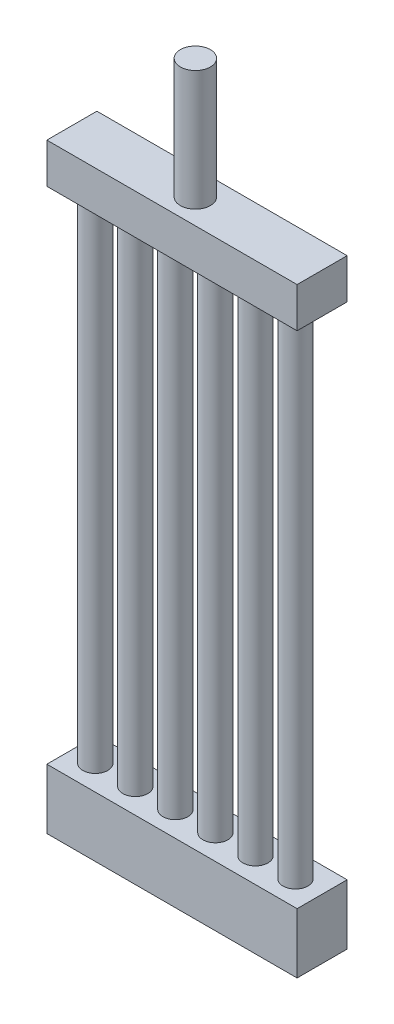
from build123d import *

# Parameters (mm, degrees)
CROSSHEAD_START    = 54
SKETCH1_W          = 5
SKETCH1_H          = 6
CROSSHEAD_DEPTH    = 25
SMA_SPRING1_START  = 196
SKETCH2_R          = 1.25
SMA_SPRING1_DEPTH  = 50
SMA_SPRING2_START  = 196
SKETCH3_R          = 1.25
SMA_SPRING2_DEPTH  = 50
SMA_SPRING3_START  = 196
SKETCH4_R          = 1.25
SMA_SPRING3_DEPTH  = 50
SMA_SPRING4_START  = 196
SKETCH5_R          = 1.25
SMA_SPRING4_DEPTH  = 50
SMA_SPRING5_START  = 196
SKETCH6_R          = 1.25
SMA_SPRING5_DEPTH  = 50
SMA_SPRING6_START  = 196
SKETCH7_R          = 1.25
SMA_SPRING6_DEPTH  = 50
ANCHOR_PLATE_START = 54
SKETCH8_W          = 5
SKETCH8_H          = 4
ANCHOR_PLATE_DEPTH = 25
HOOK_START         = 250
SKETCH9_R          = 1.5
HOOK_DEPTH         = 12


with BuildPart() as part:
    # Sketch1 → crosshead (new body)
    with BuildSketch(Plane(origin=(0, 0, 0), x_dir=(0, 0, -1), z_dir=(1, 0, 0)).offset(CROSSHEAD_START)):
        with Locations((-36.5, 193)):
            Rectangle(SKETCH1_W, SKETCH1_H)
    extrude(amount=CROSSHEAD_DEPTH)


with BuildPart() as body_2:
    # Sketch2 → sma_spring1 (new body)
    with BuildSketch(Plane(origin=(0, 0, 0), x_dir=(1, 0, 0), z_dir=(0, 1, 0)).offset(SMA_SPRING1_START)):
        with Locations((56.34, -36.5)):
            Circle(SKETCH2_R)
    extrude(amount=SMA_SPRING1_DEPTH)


with BuildPart() as body_3:
    # Sketch3 → sma_spring2 (new body)
    with BuildSketch(Plane(origin=(0, 0, 0), x_dir=(1, 0, 0), z_dir=(0, 1, 0)).offset(SMA_SPRING2_START)):
        with Locations((60.34, -36.5)):
            Circle(SKETCH3_R)
    extrude(amount=SMA_SPRING2_DEPTH)


with BuildPart() as body_4:
    # Sketch4 → sma_spring3 (new body)
    with BuildSketch(Plane(origin=(0, 0, 0), x_dir=(1, 0, 0), z_dir=(0, 1, 0)).offset(SMA_SPRING3_START)):
        with Locations((64.34, -36.5)):
            Circle(SKETCH4_R)
    extrude(amount=SMA_SPRING3_DEPTH)


with BuildPart() as body_5:
    # Sketch5 → sma_spring4 (new body)
    with BuildSketch(Plane(origin=(0, 0, 0), x_dir=(1, 0, 0), z_dir=(0, 1, 0)).offset(SMA_SPRING4_START)):
        with Locations((68.34, -36.5)):
            Circle(SKETCH5_R)
    extrude(amount=SMA_SPRING4_DEPTH)


with BuildPart() as body_6:
    # Sketch6 → sma_spring5 (new body)
    with BuildSketch(Plane(origin=(0, 0, 0), x_dir=(1, 0, 0), z_dir=(0, 1, 0)).offset(SMA_SPRING5_START)):
        with Locations((72.34, -36.5)):
            Circle(SKETCH6_R)
    extrude(amount=SMA_SPRING5_DEPTH)


with BuildPart() as body_7:
    # Sketch7 → sma_spring6 (new body)
    with BuildSketch(Plane(origin=(0, 0, 0), x_dir=(1, 0, 0), z_dir=(0, 1, 0)).offset(SMA_SPRING6_START)):
        with Locations((76.34, -36.5)):
            Circle(SKETCH7_R)
    extrude(amount=SMA_SPRING6_DEPTH)


with BuildPart() as body_8:
    # Sketch8 → anchor_plate (new body)
    with BuildSketch(Plane(origin=(0, 0, 0), x_dir=(0, 0, -1), z_dir=(1, 0, 0)).offset(ANCHOR_PLATE_START)):
        with Locations((-36.5, 248)):
            Rectangle(SKETCH8_W, SKETCH8_H)
    extrude(amount=ANCHOR_PLATE_DEPTH)


with BuildPart() as body_9:
    # Sketch9 → hook (new body)
    with BuildSketch(Plane(origin=(0, 0, 0), x_dir=(1, 0, 0), z_dir=(0, 1, 0)).offset(HOOK_START)):
        with Locations((66.34, -36.5)):
            Circle(SKETCH9_R)
    extrude(amount=HOOK_DEPTH)


solid = Compound([part.part, body_2.part, body_3.part, body_4.part, body_5.part, body_6.part, body_7.part, body_8.part, body_9.part])
